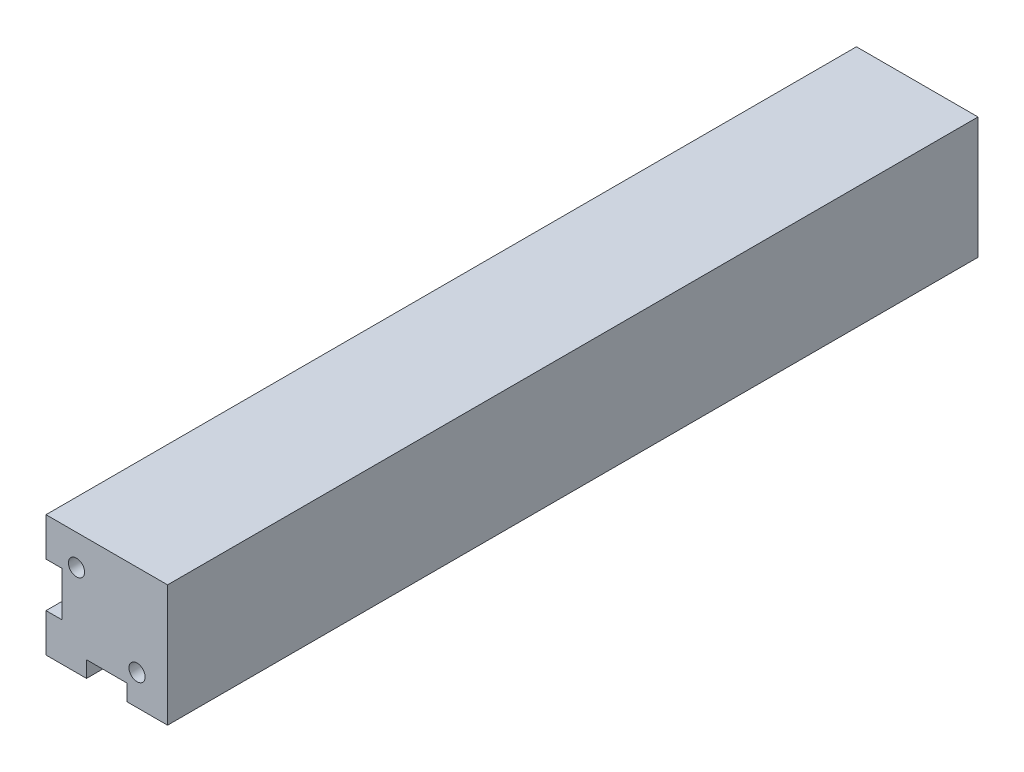
from build123d import *

# Parameters (mm, degrees)
CROQUIS1_W              = 30
CROQUIS1_H              = 30
SALIENTE_EXTRUIR1_DEPTH = 200
CROQUIS2_R              = 2
CORTAR_EXTRUIR1_DEPTH   = 25
CROQUIS4_R              = 2
CORTAR_EXTRUIR3_DEPTH   = 25
CROQUIS5_W              = 10
CROQUIS5_H              = 8
CROQUIS5_W_2            = 8
CROQUIS5_H_2            = 11
CORTAR_EXTRUIR4_DEPTH   = 200


with BuildPart() as part:
    # Croquis1 → Saliente-Extruir1 (new body)
    with BuildSketch(Plane.XY):
        Rectangle(CROQUIS1_W, CROQUIS1_H)
    extrude(amount=SALIENTE_EXTRUIR1_DEPTH)

    # Croquis2 → Cortar-Extruir1 (cut)
    with BuildSketch(Plane.XY.offset(200)):
        with Locations((-7.470583143, 7.470583143)):
            Circle(CROQUIS2_R)
        with Locations((7.470583143, -7.470583143)):
            Circle(CROQUIS2_R)
    extrude(amount=-CORTAR_EXTRUIR1_DEPTH, mode=Mode.SUBTRACT)

    # Croquis4 → Cortar-Extruir3 (cut)
    with BuildSketch(Plane(origin=(0, 0, 0), x_dir=(-1, 0, 0), z_dir=(0, 0, -1))):
        Circle(CROQUIS4_R)
    extrude(amount=-CORTAR_EXTRUIR3_DEPTH, mode=Mode.SUBTRACT)

    # Croquis5 → Cortar-Extruir4 (cut)
    with BuildSketch(Plane(origin=(0, 0, 0), x_dir=(-1, 0, 0), z_dir=(0, 0, -1))):
        with Locations((0, -15)):
            Rectangle(CROQUIS5_W, CROQUIS5_H)
        with Locations((15, 0)):
            Rectangle(CROQUIS5_W_2, CROQUIS5_H_2)
    extrude(amount=-CORTAR_EXTRUIR4_DEPTH, mode=Mode.SUBTRACT)


solid = part.part
